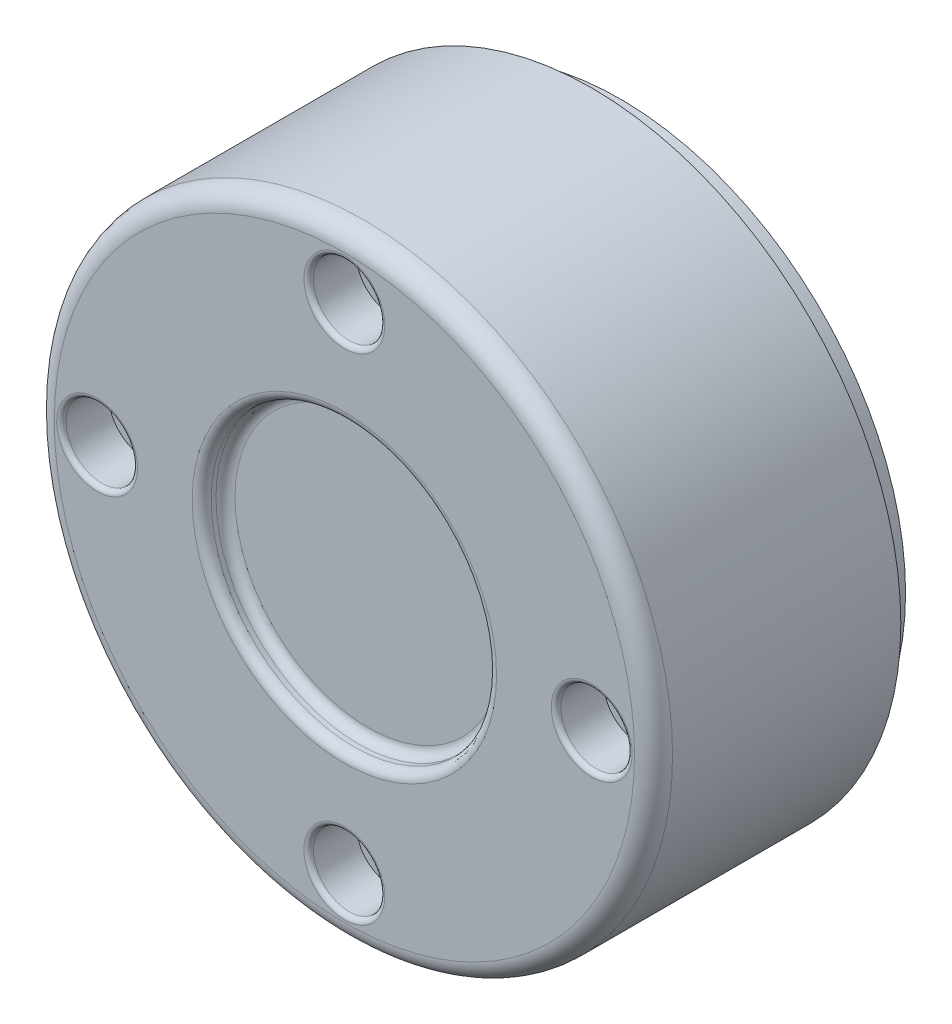
from build123d import *

# Parameters (mm, degrees)
SKETCH2_R                = 3.75
CUT_EXTRUDE1_DEPTH       = 5
FILLET1_R                = 0.5
CIRPATTERN2_COUNT        = 4
FILLET1_OF_CIRPATTERN2_R = 0.5
FILLET2_R                = 1
FILLET3_R                = 2
SHELL1_START             = -29
SHELL1_OUTLINE_R         = 28
SHELL1_DEPTH             = 22
SHELL1_START_2           = -24
SHELL1_2_DEPTH           = 19.5
SHELL1_3_DEPTH           = 17
SHELL1_START_3           = -4.5
SHELL1_4_DEPTH           = 2.5
SHELL1_6_OUTLINE_R       = 16.958039892
SHELL1_6_DEPTH           = 2.5


with BuildPart() as part:
    # Sketch1 → Revolve1 (revolve)
    with BuildSketch(Plane(origin=(0, 0, 0), x_dir=(1, 0, 0), z_dir=(0, 1, 0))):
        Polygon((0, 29), (30, 29), (30, 26), (32.5, 26), (32.5, 0), (15, 0), (15, 2.5), (0, 2.5), align=None)
    revolve(axis=Axis((0, 0, -2.5), (0, 0, -1)))

    # Sketch2 → Cut-Extrude1 (cut)
    with BuildSketch(Plane.XY):
        with Locations((0, 26)):
            Circle(SKETCH2_R)
    cut_extrude1 = extrude(amount=-CUT_EXTRUDE1_DEPTH, mode=Mode.SUBTRACT)

    # Fillet1
    fillet1_edges = [part.edges().sort_by_distance(p)[0] for p in [
        (-3.75, 26, 0),
    ]]
    fillet(fillet1_edges, radius=FILLET1_R)

    # CirPattern2: Cut-Extrude1 ×4 about axis
    cirpattern2_axis = Axis((0, 0, 0), (0, 0, 1))
    for i in range(1, CIRPATTERN2_COUNT):
        add(cut_extrude1.rotate(cirpattern2_axis, i * 360 / CIRPATTERN2_COUNT), mode=Mode.SUBTRACT)

    # Fillet1 of CirPattern2
    fillet1_of_cirpattern2_edges = [part.edges().sort_by_distance(p)[0] for p in [
        (-26, -3.75, 0),
        (3.75, -26, 0),
        (26, 3.75, 0),
    ]]
    fillet(fillet1_of_cirpattern2_edges, radius=FILLET1_OF_CIRPATTERN2_R)

    # Fillet2
    fillet2_edges = [part.edges().sort_by_distance(p)[0] for p in [
        (-15, 0, -2.5),
        (-15, 0, 0),
    ]]
    fillet(fillet2_edges, radius=FILLET2_R)

    # Fillet3
    fillet3_edges = [part.edges().sort_by_distance(p)[0] for p in [
        (-32.5, 0, 0),
    ]]
    fillet(fillet3_edges, radius=FILLET3_R)

    # Shell1: read off the stored shape, not the designer's step
    # Shell1 outline → Shell1 (cut)
    with BuildSketch(Plane.XY.offset(SHELL1_START)):
        Circle(SHELL1_OUTLINE_R)
    extrude(amount=SHELL1_DEPTH, mode=Mode.SUBTRACT)

    # Shell1 2 outline → Shell1 2 (cut)
    with BuildSketch(Plane.XY.offset(SHELL1_START_2)):
        with BuildLine():
            ThreePointArc((30.253605769, 3.869022869), (21.566756826, 21.566756826), (3.869022869, 30.253605769))
            ThreePointArc((3.869022869, 30.253605769), (0, 20.25), (-3.869022869, 30.253605769))
            ThreePointArc((-3.869022869, 30.253605769), (-21.566756826, 21.566756826), (-30.253605769, 3.869022869))
            ThreePointArc((-30.253605769, 3.869022869), (-20.25, 0), (-30.253605769, -3.869022869))
            ThreePointArc((-30.253605769, -3.869022869), (-21.566756826, -21.566756826), (-3.869022869, -30.253605769))
            ThreePointArc((-3.869022869, -30.253605769), (0, -20.25), (3.869022869, -30.253605769))
            ThreePointArc((3.869022869, -30.253605769), (21.566756826, -21.566756826), (30.253605769, -3.869022869))
            ThreePointArc((30.253605769, -3.869022869), (20.25, 0), (30.253605769, 3.869022869))
        make_face()
    extrude(amount=SHELL1_2_DEPTH, mode=Mode.SUBTRACT)

    # Shell1 3 outline → Shell1 3 (cut)
    with BuildSketch(Plane.XY.offset(SHELL1_START_2)):
        with BuildLine():
            ThreePointArc((27.441105769, 5.566481309), (28, 0), (27.441105769, -5.566481309))
            ThreePointArc((27.441105769, -5.566481309), (28.971157378, -4.922877597), (30.253605769, -3.869022869))
            ThreePointArc((30.253605769, -3.869022869), (30.5, 0), (30.253605769, 3.869022869))
            ThreePointArc((30.253605769, 3.869022869), (28.971157378, 4.922877597), (27.441105769, 5.566481309))
        make_face()
        with BuildLine():
            ThreePointArc((-5.566481309, 27.441105769), (0, 28), (5.566481309, 27.441105769))
            ThreePointArc((5.566481309, 27.441105769), (4.922877597, 28.971157378), (3.869022869, 30.253605769))
            ThreePointArc((3.869022869, 30.253605769), (0, 30.5), (-3.869022869, 30.253605769))
            ThreePointArc((-3.869022869, 30.253605769), (-4.922877597, 28.971157378), (-5.566481309, 27.441105769))
        make_face()
        with BuildLine():
            ThreePointArc((3.869022869, -30.253605769), (4.922877597, -28.971157378), (5.566481309, -27.441105769))
            ThreePointArc((5.566481309, -27.441105769), (0, -28), (-5.566481309, -27.441105769))
            ThreePointArc((-5.566481309, -27.441105769), (-4.922877597, -28.971157378), (-3.869022869, -30.253605769))
            ThreePointArc((-3.869022869, -30.253605769), (0, -30.5), (3.869022869, -30.253605769))
        make_face()
        with BuildLine():
            ThreePointArc((-27.441105769, -5.566481309), (-28, 0), (-27.441105769, 5.566481309))
            ThreePointArc((-27.441105769, 5.566481309), (-28.971157378, 4.922877597), (-30.253605769, 3.869022869))
            ThreePointArc((-30.253605769, 3.869022869), (-30.5, 0), (-30.253605769, -3.869022869))
            ThreePointArc((-30.253605769, -3.869022869), (-28.971157378, -4.922877597), (-27.441105769, -5.566481309))
        make_face()
    extrude(amount=SHELL1_3_DEPTH, mode=Mode.SUBTRACT)

    # Shell1 4 outline → Shell1 4 (cut)
    with BuildSketch(Plane.XY.offset(SHELL1_START_3)):
        with BuildLine():
            ThreePointArc((5.566481309, 27.441105769), (19.798989873, 19.798989873), (27.441105769, 5.566481309))
            ThreePointArc((27.441105769, 5.566481309), (28.971157378, 4.922877597), (30.253605769, 3.869022869))
            ThreePointArc((30.253605769, 3.869022869), (21.566756826, 21.566756826), (3.869022869, 30.253605769))
            ThreePointArc((3.869022869, 30.253605769), (4.922877597, 28.971157378), (5.566481309, 27.441105769))
        make_face()
        with BuildLine():
            ThreePointArc((30.253605769, -3.869022869), (28.971157378, -4.922877597), (27.441105769, -5.566481309))
            ThreePointArc((27.441105769, -5.566481309), (19.798989873, -19.798989873), (5.566481309, -27.441105769))
            ThreePointArc((5.566481309, -27.441105769), (4.922877597, -28.971157378), (3.869022869, -30.253605769))
            ThreePointArc((3.869022869, -30.253605769), (21.566756826, -21.566756826), (30.253605769, -3.869022869))
        make_face()
        with BuildLine():
            ThreePointArc((-27.441105769, 5.566481309), (-19.798989873, 19.798989873), (-5.566481309, 27.441105769))
            ThreePointArc((-5.566481309, 27.441105769), (-4.922877597, 28.971157378), (-3.869022869, 30.253605769))
            ThreePointArc((-3.869022869, 30.253605769), (-21.566756826, 21.566756826), (-30.253605769, 3.869022869))
            ThreePointArc((-30.253605769, 3.869022869), (-28.971157378, 4.922877597), (-27.441105769, 5.566481309))
        make_face()
        with BuildLine():
            ThreePointArc((-3.869022869, -30.253605769), (-4.922877597, -28.971157378), (-5.566481309, -27.441105769))
            ThreePointArc((-5.566481309, -27.441105769), (-19.798989873, -19.798989873), (-27.441105769, -5.566481309))
            ThreePointArc((-27.441105769, -5.566481309), (-28.971157378, -4.922877597), (-30.253605769, -3.869022869))
            ThreePointArc((-30.253605769, -3.869022869), (-21.566756826, -21.566756826), (-3.869022869, -30.253605769))
        make_face()
    extrude(amount=SHELL1_4_DEPTH, mode=Mode.SUBTRACT)

    # Shell1 5 outline → Shell1 5 (revolve, cut)
    with BuildSketch(Plane.XZ):
        with BuildLine():
            ThreePointArc((16.958039892, -2), (15.936491673, -3.791287847), (14, -4.5))
            Line((14, -4.5), (16.958039892, -4.5))
            Line((16.958039892, -4.5), (16.958039892, -2))
        make_face()
    revolve(axis=Axis((0, 0, 0), (0, 0, 1)), mode=Mode.SUBTRACT)

    # Shell1 6 outline → Shell1 6 (cut)
    with BuildSketch(Plane.XY.offset(SHELL1_START_3)):
        with BuildLine():
            ThreePointArc((5.566481309, 27.441105769), (0, 20.25), (-5.566481309, 27.441105769))
            ThreePointArc((-5.566481309, 27.441105769), (-19.798989873, 19.798989873), (-27.441105769, 5.566481309))
            ThreePointArc((-27.441105769, 5.566481309), (-20.25, 0), (-27.441105769, -5.566481309))
            ThreePointArc((-27.441105769, -5.566481309), (-19.798989873, -19.798989873), (-5.566481309, -27.441105769))
            ThreePointArc((-5.566481309, -27.441105769), (0, -20.25), (5.566481309, -27.441105769))
            ThreePointArc((5.566481309, -27.441105769), (19.798989873, -19.798989873), (27.441105769, -5.566481309))
            ThreePointArc((27.441105769, -5.566481309), (20.25, 0), (27.441105769, 5.566481309))
            ThreePointArc((27.441105769, 5.566481309), (19.798989873, 19.798989873), (5.566481309, 27.441105769))
        make_face()
        Circle(SHELL1_6_OUTLINE_R, mode=Mode.SUBTRACT)
    extrude(amount=SHELL1_6_DEPTH, mode=Mode.SUBTRACT)


solid = part.part
